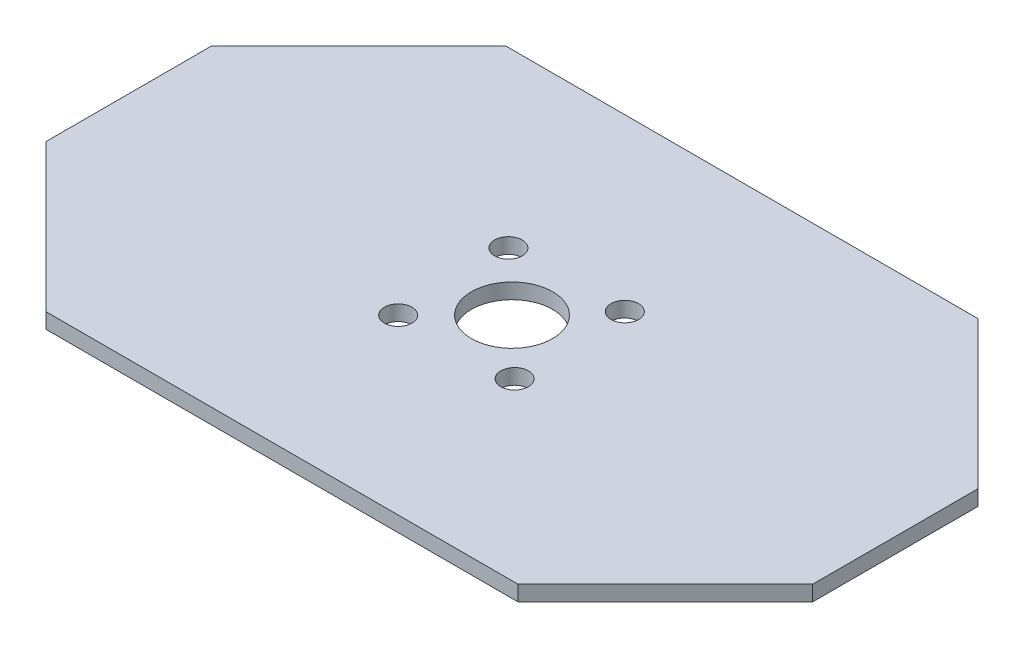
from build123d import *

# Parameters (mm, degrees)
SALIENTE_EXTRUIR1_DEPTH = 2
CORTAR_EXTRUIR1_REACH   = 60.344
CROQUIS2_R              = 5.3
CROQUIS2_R_2            = 1.8


with BuildPart() as part:
    # Croquis1 → Saliente-Extruir1 (new body)
    with BuildSketch(Plane(origin=(0, 0, 0), x_dir=(1, 0, 0), z_dir=(0, 1, 0))):
        Polygon((-50, 10.783872382), (-30.783872382, 30), (30.783872382, 30), (50, 10.783872382), (50, -10.783872382), (30.783872382, -30), (-30.783872382, -30), (-50, -10.783872382), align=None)
    extrude(amount=SALIENTE_EXTRUIR1_DEPTH)

    # Croquis2 → Cortar-Extruir1 (cut, up to next)
    with BuildSketch(Plane(origin=(0, 2, 0), x_dir=(1, 0, 0), z_dir=(0, 1, 0)), mode=Mode.PRIVATE) as cortar_extruir1_sk1:
        Circle(CROQUIS2_R)
    cortar_extruir1_tool1 = extrude(cortar_extruir1_sk1.sketch, amount=-CORTAR_EXTRUIR1_REACH, mode=Mode.PRIVATE) & part.part
    # Croquis2 → Cortar-Extruir1 (cut, up to next)
    with BuildSketch(Plane(origin=(0, 2, 0), x_dir=(1, 0, 0), z_dir=(0, 1, 0)), mode=Mode.PRIVATE) as cortar_extruir1_sk2:
        with Locations((-7.424621202, -7.424621202)):
            Circle(CROQUIS2_R_2)
    cortar_extruir1_tool2 = extrude(cortar_extruir1_sk2.sketch, amount=-CORTAR_EXTRUIR1_REACH, mode=Mode.PRIVATE) & part.part
    # Croquis2 → Cortar-Extruir1 (cut, up to next)
    with BuildSketch(Plane(origin=(0, 2, 0), x_dir=(1, 0, 0), z_dir=(0, 1, 0)), mode=Mode.PRIVATE) as cortar_extruir1_sk3:
        with Locations((-7.827733398, 7.357422898)):
            Circle(CROQUIS2_R_2)
    cortar_extruir1_tool3 = extrude(cortar_extruir1_sk3.sketch, amount=-CORTAR_EXTRUIR1_REACH, mode=Mode.PRIVATE) & part.part
    # Croquis2 → Cortar-Extruir1 (cut, up to next)
    with BuildSketch(Plane(origin=(0, 2, 0), x_dir=(1, 0, 0), z_dir=(0, 1, 0)), mode=Mode.PRIVATE) as cortar_extruir1_sk4:
        with Locations((6.954310702, 7.760535094)):
            Circle(CROQUIS2_R_2)
    cortar_extruir1_tool4 = extrude(cortar_extruir1_sk4.sketch, amount=-CORTAR_EXTRUIR1_REACH, mode=Mode.PRIVATE) & part.part
    # Croquis2 → Cortar-Extruir1 (cut, up to next)
    with BuildSketch(Plane(origin=(0, 2, 0), x_dir=(1, 0, 0), z_dir=(0, 1, 0)), mode=Mode.PRIVATE) as cortar_extruir1_sk5:
        with Locations((7.357422898, -7.021509007)):
            Circle(CROQUIS2_R_2)
    cortar_extruir1_tool5 = extrude(cortar_extruir1_sk5.sketch, amount=-CORTAR_EXTRUIR1_REACH, mode=Mode.PRIVATE) & part.part
    add(cortar_extruir1_tool1.solids().sort_by_distance((0, 2, 0))[0], mode=Mode.SUBTRACT)
    add(cortar_extruir1_tool2.solids().sort_by_distance((-7.424621, 2, 7.424621))[0], mode=Mode.SUBTRACT)
    add(cortar_extruir1_tool3.solids().sort_by_distance((-7.827733, 2, -7.357423))[0], mode=Mode.SUBTRACT)
    add(cortar_extruir1_tool4.solids().sort_by_distance((6.954311, 2, -7.760535))[0], mode=Mode.SUBTRACT)
    add(cortar_extruir1_tool5.solids().sort_by_distance((7.357423, 2, 7.021509))[0], mode=Mode.SUBTRACT)


solid = part.part
